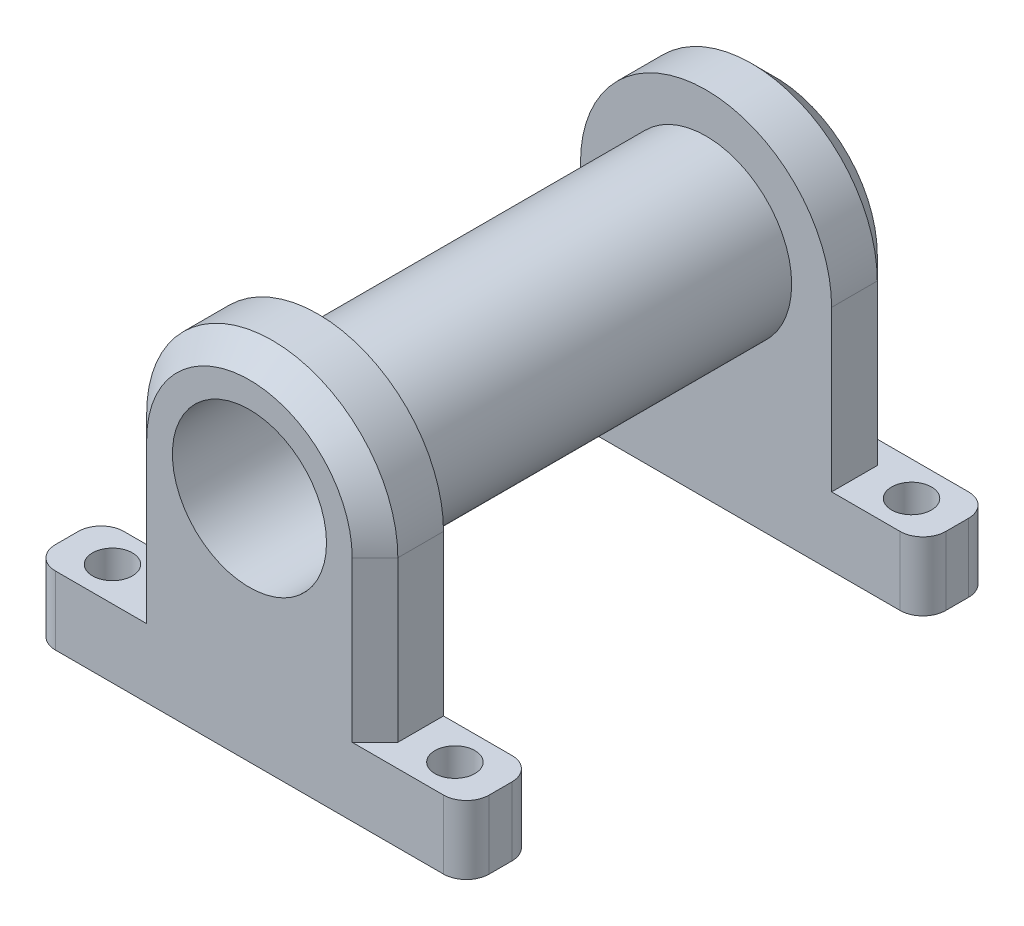
from build123d import *

# Parameters (mm, degrees)
BOSS_EXTRUDE1_DEPTH = 6
SKETCH2_R           = 7.5
BOSS_EXTRUDE2_DEPTH = 34
BOSS_EXTRUDE3_DEPTH = 6
SKETCH4_R           = 6.75
CUT_EXTRUDE1_DEPTH  = 54.637673328
SKETCH5_R           = 2.25
CUT_EXTRUDE2_DEPTH  = 13
SKETCH9_R           = 1.75
CUT_EXTRUDE5_DEPTH  = 56.695601263
FILLET1_R           = 2
CHAMFER4_SIZE       = 2


with BuildPart() as part:
    # Sketch1 → Boss-Extrude1 (new body)
    with BuildSketch(Plane.XY):
        with BuildLine():
            Line((-11, 0), (-11, -14))
            Line((-11, -14), (-19, -14))
            Line((-19, -14), (-19, -20))
            Line((-19, -20), (-11, -20))
            Line((-11, -20), (11, -20))
            Line((11, -20), (19, -20))
            Line((19, -20), (19, -14))
            Line((19, -14), (11, -14))
            Line((11, -14), (11, 0))
            ThreePointArc((11, 0), (0, 11), (-11, 0))
        make_face()
    extrude(amount=BOSS_EXTRUDE1_DEPTH)

    # Sketch2 → Boss-Extrude2 (add)
    with BuildSketch(Plane.XY.offset(6)):
        Circle(SKETCH2_R)
    extrude(amount=BOSS_EXTRUDE2_DEPTH)

    # Sketch3 → Boss-Extrude3 (add)
    with BuildSketch(Plane.XY.offset(40)):
        with BuildLine():
            Line((-11, 0), (-11, -14))
            Line((-11, -14), (-19, -14))
            Line((-19, -14), (-19, -20))
            Line((-19, -20), (19, -20))
            Line((19, -20), (19, -14))
            Line((19, -14), (11, -14))
            Line((11, -14), (11, 0))
            ThreePointArc((11, 0), (0, 11), (-11, 0))
        make_face()
    extrude(amount=BOSS_EXTRUDE3_DEPTH)

    # Sketch4 → Cut-Extrude1 (cut, through all)
    with BuildSketch(Plane.XY.offset(46)):
        Circle(SKETCH4_R)
    extrude(amount=-CUT_EXTRUDE1_DEPTH, mode=Mode.SUBTRACT)

    # Sketch5 → Cut-Extrude2 (cut)
    with BuildSketch(Plane.XZ.offset(20)):
        with Locations((-5, 43)):
            Circle(SKETCH5_R)
        with Locations((5, 43)):
            Circle(SKETCH5_R)
        with Locations((-5, 3)):
            Circle(SKETCH5_R)
        with Locations((5, 3)):
            Circle(SKETCH5_R)
    extrude(amount=-CUT_EXTRUDE2_DEPTH, mode=Mode.SUBTRACT)

    # Sketch9 → Cut-Extrude5 (cut, through all)
    with BuildSketch(Plane(origin=(0, -14, 0), x_dir=(1, 0, 0), z_dir=(0, 1, 0))):
        with Locations((15, -43)):
            Circle(SKETCH9_R)
        with Locations((-15, -43)):
            Circle(SKETCH9_R)
        with Locations((15, -3)):
            Circle(SKETCH9_R)
        with Locations((-15, -3)):
            Circle(SKETCH9_R)
    extrude(amount=-CUT_EXTRUDE5_DEPTH, mode=Mode.SUBTRACT)

    # Fillet1
    fillet1_edges = [part.edges().sort_by_distance(p)[0] for p in [
        (-19, -17, 0),
        (-19, -17, 40),
        (-19, -17, 6),
        (-19, -17, 46),
        (19, -17, 46),
        (19, -17, 40),
        (19, -17, 6),
        (19, -17, 0),
    ]]
    fillet(fillet1_edges, radius=FILLET1_R)

    # Chamfer4
    chamfer4_edges = [part.edges().sort_by_distance(p)[0] for p in [
        (11, -7, 0),
        (-11, -7, 0),
        (0, 11, 0),
        (11, -7, 46),
        (0, 11, 46),
        (-11, -7, 46),
    ]]
    chamfer(chamfer4_edges, length=CHAMFER4_SIZE)


solid = part.part
